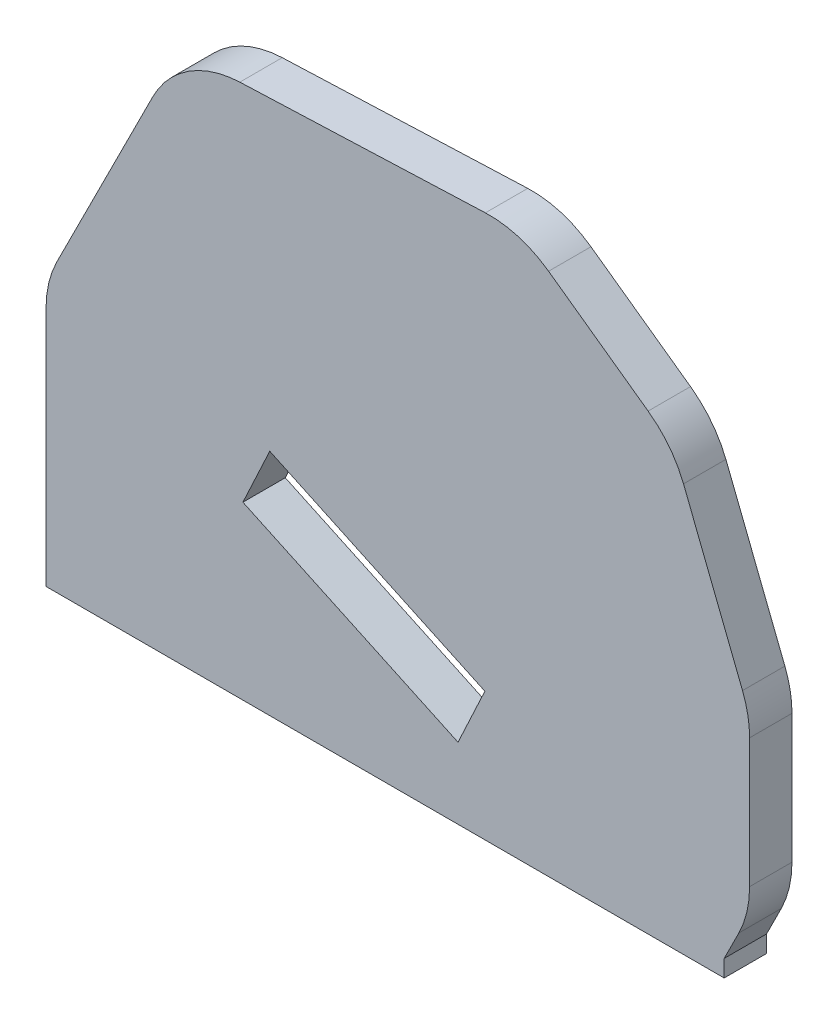
from build123d import *

# Parameters (mm, degrees)
BOSS_EXTRUDE1_DEPTH = 0.125
FILLET1_R           = 0.6


with BuildPart() as part:
    # frame_outline → Boss-Extrude1 (new, symmetric)
    with BuildSketch(Plane.XY):
        Polygon((0, 0), (4, 0), (4, 0.1), (4.15, 0.4), (4.15, 1.416096183), (3.695232724, 2.568743907), (2.797078859, 3.212298026), (0.789408464, 3.133982378), (0, 1.562826413), align=None)
        Polygon((1.161298437, 1.010989603), (2.430129339, 0.419324036), (2.588611187, 0.759189456), (1.319780285, 1.350855023), align=None, mode=Mode.SUBTRACT)
    extrude(amount=BOSS_EXTRUDE1_DEPTH, both=True)

    # Fillet1
    fillet1_edges = [part.edges().sort_by_distance(p)[0] for p in [
        (4.15, 0.4, 0),
        (4.15, 1.416096183, 0),
        (3.695232724, 2.568743907, 0),
        (2.797078859, 3.212298026, 0),
        (0.789408464, 3.133982378, 0),
        (0, 1.562826413, 0),
    ]]
    fillet(fillet1_edges, radius=FILLET1_R)


solid = part.part
